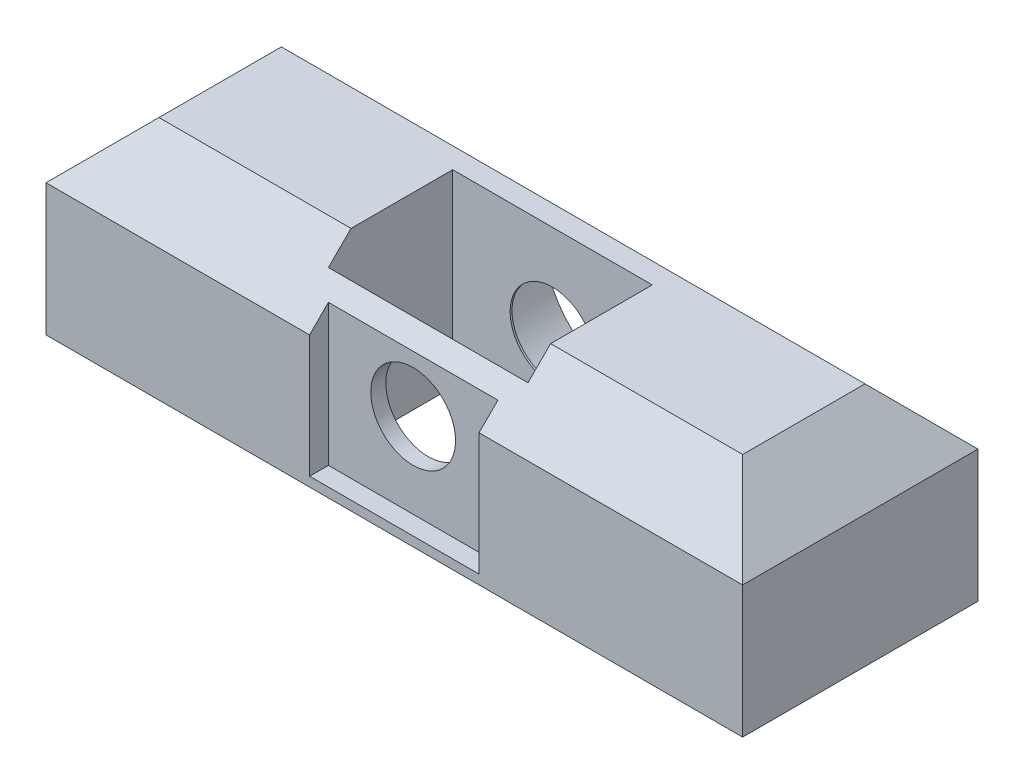
from build123d import *

# Parameters (mm, degrees)
SKETCH_1_W          = 37
SKETCH_1_H          = 10
EXTRUDE_1_DEPTH     = 4.5
SKETCH_4_W          = 13.4
SKETCH_4_H          = 10
EXTRUDE_2_DEPTH     = 6
SKETCH_5_W          = 10.2
SKETCH_5_H          = 10
CUT_EXTRUDE_4_DEPTH = 0.2
SKETCH_6_W          = 37
SKETCH_6_H          = 10
EXTRUDE_3_DEPTH     = 2
SKETCH_2_R          = 2.25
CUT_EXTRUDE_1_DEPTH = 23.880122377
SKETCH_3_R          = 4.5
CUT_EXTRUDE_3_DEPTH = 4
SKETCH_7_W          = 9
SKETCH_7_H          = 9
CUT_EXTRUDE_5_DEPTH = 1
CHAMFER_1_SIZE      = 3
SKETCH_8_W          = 10.6
SKETCH_8_H          = 6.6
CUT_EXTRUDE_6_DEPTH = 25.464259645


with BuildPart() as part:
    # 스케치1 → 보스-돌출1 (new body)
    with BuildSketch(Plane.XY):
        Rectangle(SKETCH_1_W, SKETCH_1_H)
    extrude(amount=EXTRUDE_1_DEPTH)

    # 스케치4 → 보스-돌출2 (add)
    with BuildSketch(Plane.XY.offset(4.5)):
        with Locations((-11.8, 0)):
            Rectangle(SKETCH_4_W, SKETCH_4_H)
        with Locations((11.8, 0)):
            Rectangle(SKETCH_4_W, SKETCH_4_H)
    extrude(amount=EXTRUDE_2_DEPTH)

    # 스케치5 → 컷-돌출4 (cut)
    with BuildSketch(Plane.XY.offset(4.5)):
        Rectangle(SKETCH_5_W, SKETCH_5_H)
    extrude(amount=-CUT_EXTRUDE_4_DEPTH, mode=Mode.SUBTRACT)

    # 스케치6 → 보스-돌출3 (add)
    with BuildSketch(Plane.XY.offset(10.5)):
        Rectangle(SKETCH_6_W, SKETCH_6_H)
    extrude(amount=EXTRUDE_3_DEPTH)

    # 스케치2 → 컷-돌출1 (cut, through all)
    with BuildSketch(Plane.XY):
        with Locations(Location((0, 0, 0), (0, 0, 180))):
            Circle(SKETCH_2_R)
    extrude(amount=CUT_EXTRUDE_1_DEPTH, mode=Mode.SUBTRACT)

    # 스케치3 → 컷-돌출3 (cut)
    with BuildSketch(Plane(origin=(0, 0, 0), x_dir=(-1, 0, 0), z_dir=(0, 0, -1))):
        Circle(SKETCH_3_R)
    extrude(amount=-CUT_EXTRUDE_3_DEPTH, mode=Mode.SUBTRACT)

    # 스케치7 → 컷-돌출5 (cut)
    with BuildSketch(Plane.XY.offset(12.5)):
        Rectangle(SKETCH_7_W, SKETCH_7_H)
    extrude(amount=-CUT_EXTRUDE_5_DEPTH, mode=Mode.SUBTRACT)

    # 모따기1
    # the kernel refuses this chamfer: 3 mm, written as the material it takes off along each edge
    with BuildSketch(Plane(origin=(-26.215048964, 5, 0), x_dir=(0, 0.02749587661058649, 0.9996219169112968), z_dir=(1, 0, 0)), Plane(origin=(26.215048964, 5, 12.5), x_dir=(0, 0.027495876610586494, -0.9996219169112968), z_dir=(-1, 0, 0))) as chamfer_1_piece_1:
        Polygon((CHAMFER_1_SIZE * 0.999621916911, CHAMFER_1_SIZE * 0.0274958766106), (-CHAMFER_1_SIZE * 0.0274958766106, CHAMFER_1_SIZE * 0.999621916911), (0, 0), align=None)
    extrude(amount=52.430097928, mode=Mode.SUBTRACT)
    with BuildSketch(Plane(origin=(18.5, 5, 20.215048964), x_dir=(-0.9996219169112969, 0.027495876610586497, 0), z_dir=(0, 0, -1)), Plane(origin=(-18.5, 5, -7.715048964), x_dir=(0.9996219169112969, 0.027495876610586497, 0), z_dir=(0, 0, 1))) as chamfer_1_piece_2:
        Polygon((CHAMFER_1_SIZE * 0.999621916911, -CHAMFER_1_SIZE * 0.0274958766106), (-CHAMFER_1_SIZE * 0.0274958766106, -CHAMFER_1_SIZE * 0.999621916911), (0, 0), align=None)
    extrude(amount=27.930097928, mode=Mode.SUBTRACT)

    # 스케치8 → 컷-돌출6 (cut, through all)
    with BuildSketch(Plane(origin=(0, 5, 0), x_dir=(1, 0, 0), z_dir=(0, 1, 0))):
        with Locations((0, -7.4)):
            Rectangle(SKETCH_8_W, SKETCH_8_H)
    extrude(amount=-CUT_EXTRUDE_6_DEPTH, mode=Mode.SUBTRACT)


solid = part.part
